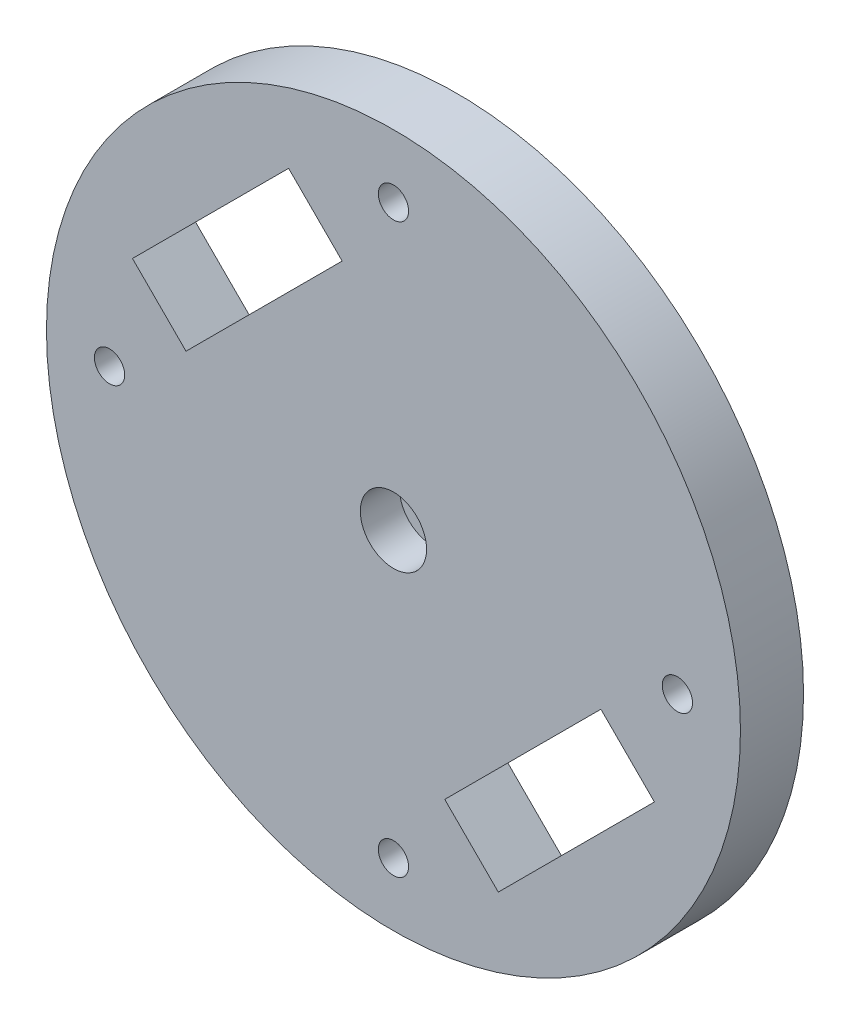
from build123d import *

# Parameters (mm, degrees)
SKETCH1_R                               = 7.5
BOSS_EXTRUDE1_DEPTH                     = 20.05
SKETCH3_W                               = 5
SKETCH3_H                               = 5
CUT_EXTRUDE1_DEPTH                      = 21
SKETCH6_R                               = 8.5
BOSS_EXTRUDE2_DEPTH                     = 24
SKETCH7_R                               = 11.25
BOSS_EXTRUDE3_DEPTH                     = 5
SKETCH8_R                               = 55
BOSS_EXTRUDE4_DEPTH                     = 10
FILLET1_R                               = 0.6
FILLET2_R                               = 5
M4_CLEARANCE_HOLE1_D                    = 4.8
M6X1_0_TAPPED_HOLE2_D                   = 5
M6X1_0_TAPPED_HOLE2_DEPTH               = 23.497848452
M6X1_0_TAPPED_HOLE2_TIP                 = 1.502151548
SKETCH13_R                              = 7.5
CUT_EXTRUDE2_DEPTH                      = 2
CUT_EXTRUDE3_REACH                      = 98.461
SKETCH15_R                              = 36.682415144
CUT_EXTRUDE4_DEPTH                      = 42.05
CBORE_FOR_M6_HEX_HEAD_BOLT1_D           = 6
CBORE_FOR_M6_HEX_HEAD_BOLT1_CBORE_D     = 10.5
CBORE_FOR_M6_HEX_HEAD_BOLT1_CBORE_DEPTH = 6.2


with BuildPart() as part:
    # Sketch1 → Boss-Extrude1 (new body)
    with BuildSketch(Plane.XY):
        Circle(SKETCH1_R)
    extrude(amount=BOSS_EXTRUDE1_DEPTH)

    # Sketch3 → Cut-Extrude1 (cut)
    with BuildSketch(Plane(origin=(0, 0, 0), x_dir=(-1, 0, 0), z_dir=(0, 0, -1))):
        with Locations((0, 7.5)):
            Rectangle(SKETCH3_W, SKETCH3_H)
    extrude(amount=-CUT_EXTRUDE1_DEPTH, mode=Mode.SUBTRACT)

    # Sketch6 → Boss-Extrude2 (add)
    with BuildSketch(Plane.XY.offset(20.05)):
        Circle(SKETCH6_R)
    extrude(amount=BOSS_EXTRUDE2_DEPTH)

    # Sketch7 → Boss-Extrude3 (add)
    with BuildSketch(Plane.XY.offset(44.05)):
        Circle(SKETCH7_R)
    extrude(amount=BOSS_EXTRUDE3_DEPTH)

    # Sketch8 → Boss-Extrude4 (add)
    with BuildSketch(Plane.XY.offset(49.05)):
        Circle(SKETCH8_R)
    extrude(amount=BOSS_EXTRUDE4_DEPTH)

    # Fillet1
    fillet1_edges = [part.edges().sort_by_distance(p)[0] for p in [
        (-8.5, 0, 44.05),
    ]]
    fillet(fillet1_edges, radius=FILLET1_R)

    # Fillet2
    fillet2_edges = [part.edges().sort_by_distance(p)[0] for p in [
        (-11.25, 0, 49.05),
    ]]
    fillet(fillet2_edges, radius=FILLET2_R - 0.0001)  # a hair under: the kernel refuses the full size

    # M4 Clearance Hole1 (through all)
    with Locations(Plane.XY.offset(59.05)):
        with Locations((0, 45), (0, -45), (45, 0), (-45, 0)):
            Hole(M4_CLEARANCE_HOLE1_D / 2)

    # M6x1.0 Tapped Hole2
    with Locations(Plane(origin=(0, 0, 0), x_dir=(-1, 0, 0), z_dir=(0, 0, -1))):
        with Locations((0, 0)):
            Hole(M6X1_0_TAPPED_HOLE2_D / 2, depth=M6X1_0_TAPPED_HOLE2_DEPTH)
            with Locations((0, 0, -(M6X1_0_TAPPED_HOLE2_DEPTH + M6X1_0_TAPPED_HOLE2_TIP / 2))):  # 118° drill point
                Cone(0, M6X1_0_TAPPED_HOLE2_D / 2, M6X1_0_TAPPED_HOLE2_TIP, mode=Mode.SUBTRACT)

    # Sketch13 → Cut-Extrude2 (cut)
    with BuildSketch(Plane(origin=(0, 0, 0), x_dir=(-1, 0, 0), z_dir=(0, 0, -1))):
        Circle(SKETCH13_R)
    extrude(amount=-CUT_EXTRUDE2_DEPTH, mode=Mode.SUBTRACT)

    # Sketch14 → Cut-Extrude3 (cut, up to next)
    with BuildSketch(Plane.XY.offset(59.05), mode=Mode.PRIVATE) as cut_extrude3_sk1:
        Polygon((-16.617009358, 41.365746699), (-41.365746699, 16.617009358), (-32.880465325, 8.131727984), (-8.131727984, 32.880465325), align=None)
    cut_extrude3_tool1 = extrude(cut_extrude3_sk1.sketch, amount=-CUT_EXTRUDE3_REACH, mode=Mode.PRIVATE) & part.part
    # Sketch14 → Cut-Extrude3 (cut, up to next)
    with BuildSketch(Plane.XY.offset(59.05), mode=Mode.PRIVATE) as cut_extrude3_sk2:
        Polygon((41.365746699, -16.617009358), (16.617009358, -41.365746699), (8.131727984, -32.880465325), (32.880465325, -8.131727984), align=None)
    cut_extrude3_tool2 = extrude(cut_extrude3_sk2.sketch, amount=-CUT_EXTRUDE3_REACH, mode=Mode.PRIVATE) & part.part
    add(cut_extrude3_tool1.solids().sort_by_distance((-24.748737, 24.748737, 59.05))[0], mode=Mode.SUBTRACT)
    add(cut_extrude3_tool2.solids().sort_by_distance((24.748737, -24.748737, 59.05))[0], mode=Mode.SUBTRACT)

    # Sketch15 → Cut-Extrude4 (cut)
    with BuildSketch(Plane(origin=(0, 0, 2), x_dir=(-1, 0, 0), z_dir=(0, 0, -1))):
        Circle(SKETCH15_R)
    extrude(amount=-CUT_EXTRUDE4_DEPTH, mode=Mode.SUBTRACT)

    # CBORE for M6 Hex Head Bolt1 (through all)
    with Locations(Plane.XY.offset(59.05)):
        with Locations((0, 0)):
            CounterBoreHole(CBORE_FOR_M6_HEX_HEAD_BOLT1_D / 2, CBORE_FOR_M6_HEX_HEAD_BOLT1_CBORE_D / 2, CBORE_FOR_M6_HEX_HEAD_BOLT1_CBORE_DEPTH)


solid = part.part
